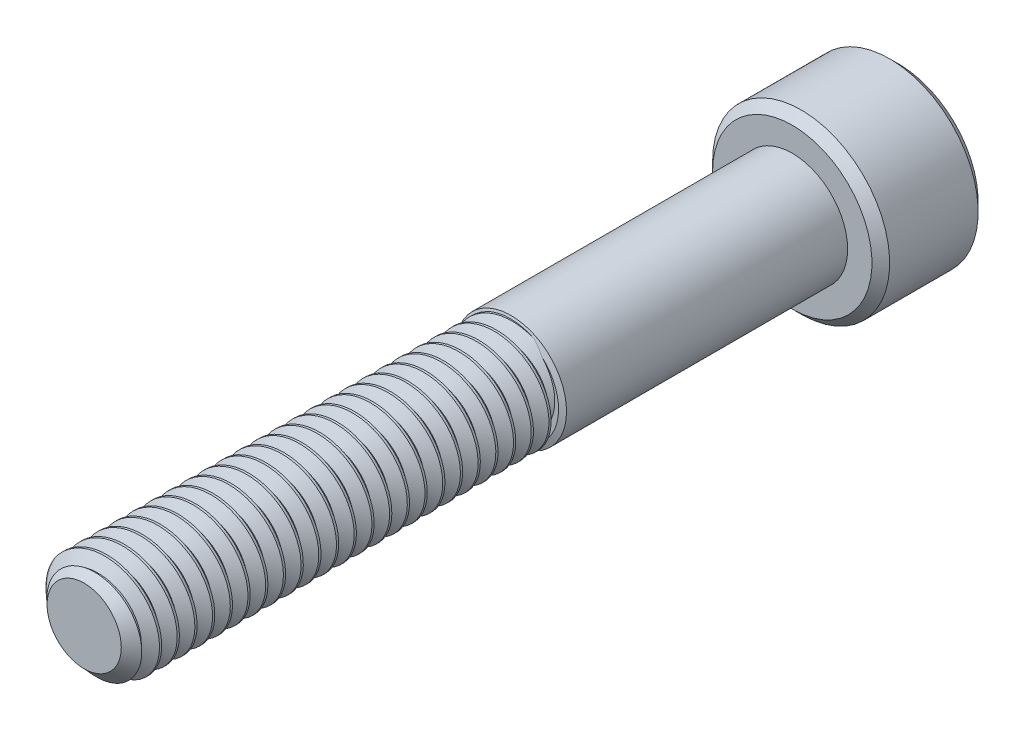
from build123d import *

# Parameters (mm, degrees)
SKETCH1_R          = 3
EXTRUDE1_DEPTH     = 40
CUT_SWEEP1_PITCH   = 1
SKETCH6_R          = 5
EXTRUDE2_DEPTH     = 6
CUT_EXTRUDE1_DEPTH = 3.75
CHAMFER1_SIZE      = 0.5


with BuildPart() as part:
    # Sketch1 → Extrude1 (new body)
    with BuildSketch(Plane.XY):
        Circle(SKETCH1_R)
    extrude(amount=-EXTRUDE1_DEPTH)

    # Cut-Sweep1: arcs per turn and ends read off the stored shape
    # Cut-Sweep1: the profile of Sketch3 profile screwed along a right-hand helix through 43 turns, 6 arcs to a turn; built about Z, then put on its axis
    cut_sweep1_z = Axis((0, 0, 0), (0, 0, 1))
    cut_sweep1_corners = [(3.0003, 0, -1.875173205), (2.350480947, 0, -1.5), (2.350480947, 0, -1.375), (3.0003, 0, -0.999826795)]
    with BuildLine(mode=Mode.PRIVATE) as cut_sweep1_profile:
        Line(cut_sweep1_corners[0], cut_sweep1_corners[1])
        Line(cut_sweep1_corners[1], cut_sweep1_corners[2])
        Line(cut_sweep1_corners[2], cut_sweep1_corners[3])
        Line(cut_sweep1_corners[3], cut_sweep1_corners[0])
    cut_sweep1_cap = Face(cut_sweep1_profile.wire())
    cut_sweep1_turn_angles = [0, 30, 60, 90, 120, 150, 180, 210, 240, 270, 300, 330, 360]
    cut_sweep1_turn_weights = [1, 0.8660254037844387, 1, 0.8660254037844387, 1, 0.8660254037844387, 1, 0.8660254037844387, 1, 0.8660254037844387, 1, 0.8660254037844387, 1]
    cut_sweep1_turn_rails = [Edge.make_bspline([Vector(p[0], p[1], 0).rotate(cut_sweep1_z, cut_sweep1_turn_angles[k]) / cut_sweep1_turn_weights[k] + Vector(0, 0, p[2] + CUT_SWEEP1_PITCH * cut_sweep1_turn_angles[k] / 360) for k in range(13)], [0, 0, 0, 1, 1, 2, 2, 3, 3, 4, 4, 5, 5, 6, 6, 6], 2, cut_sweep1_turn_weights) for p in cut_sweep1_corners]
    cut_sweep1_turn_sides = [Face.make_surface_from_curves(cut_sweep1_turn_rails[p[0]], cut_sweep1_turn_rails[p[1]]) for p in [(0, 1), (1, 2), (2, 3), (3, 0)]]
    cut_sweep1 = Plane(origin=(0, 0, 0), x_dir=(0, 1, 0), z_dir=(0, 0, -1)) * Solid(Shell([*[p.moved(Location((0, 0, CUT_SWEEP1_PITCH * i))) for i in range(43) for p in cut_sweep1_turn_sides], cut_sweep1_cap, cut_sweep1_cap.rotate(cut_sweep1_z, 15480).moved(Location((0, 0, CUT_SWEEP1_PITCH * 15480 / 360)))]))
    add(cut_sweep1, mode=Mode.SUBTRACT)

    # Sketch4 → Cut-Revolve1 (revolve, cut)
    with BuildSketch(Plane(origin=(0, 0, 0), x_dir=(0, 0, -1), z_dir=(1, 0, 0)), mode=Mode.PRIVATE) as cut_revolve1_sk:
        Polygon((0.842545147, 3), (0, 2.096480947), (0, 3), align=None)
    revolve(cut_revolve1_sk.sketch.rotate(Axis((0, 0, 0), (0, 0, -1)), 265.477705154), axis=Axis((0, 0, 0), (0, 0, -1)), mode=Mode.SUBTRACT)

    # Sketch5 → partially thread (revolve)
    with BuildSketch(Plane(origin=(0, 0, 0), x_dir=(0, 0, -1), z_dir=(1, 0, 0)), mode=Mode.PRIVATE) as partially_thread_sk:
        Polygon((40, 3.127), (24.120182971, 3.127), (24, 2.7968), (24, 0), (40, 0), align=None)
    revolve(partially_thread_sk.sketch.rotate(Axis((0, 0, 0), (0, 0, -1)), 270), axis=Axis((0, 0, 0), (0, 0, -1)))

    # Sketch6 → Extrude2 (add)
    with BuildSketch(Plane(origin=(0, 0, -40), x_dir=(-1, 0, 0), z_dir=(0, 0, -1))):
        Circle(SKETCH6_R)
    extrude(amount=EXTRUDE2_DEPTH)

    # Sketch7 → Cut-Extrude1 (cut)
    with BuildSketch(Plane(origin=(0, 0, -46), x_dir=(-1, 0, 0), z_dir=(0, 0, -1))):
        Polygon((0, 2.886751346), (-2.5, 1.443375673), (-2.5, -1.443375673), (0, -2.886751346), (2.5, -1.443375673), (2.5, 1.443375673), align=None)
    extrude(amount=-CUT_EXTRUDE1_DEPTH, mode=Mode.SUBTRACT)

    # Cut-Extrude2 cone 1 section (through the dimple's axis) → Cut-Extrude2 (revolve, cut)
    with BuildSketch(Plane(origin=(0, 0, -46), x_dir=(0, 1, 0), z_dir=(1, 0, 0))):
        Polygon((0, 0), (2.886751346, 0), (0, 2.886751346), align=None)
    revolve(axis=Axis((0, 0, -46), (0, 0, 1)), mode=Mode.SUBTRACT)

    # Chamfer1
    chamfer1_edges = [part.edges().sort_by_distance(p)[0] for p in [
        (5, 0, -40),
        (5, 0, -46),
    ]]
    chamfer(chamfer1_edges, length=CHAMFER1_SIZE)


solid = part.part
